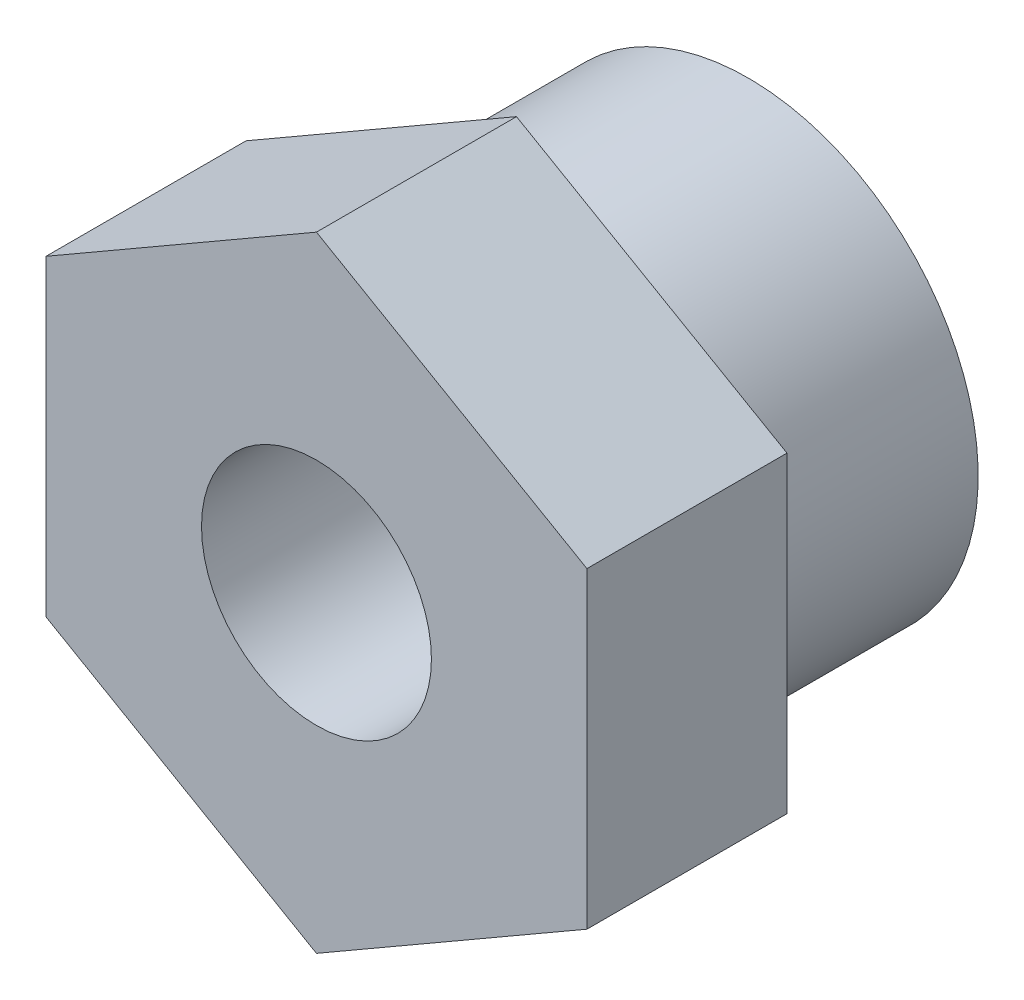
from build123d import *

# Parameters (mm, degrees)
SCHIZZO1_R                   = 17.25
ESTRUSIONE_ESTRUSIONE1_DEPTH = 23.85
TAGLIO_ESTRUSIONE1_START     = -11.05
TAGLIO_ESTRUSIONE1_DEPTH     = 11.05
FORO_25_5_12_7_1_D           = 12.7
SCHIZZO5_R                   = 17.25
SCHIZZO5_R_2                 = 12.7
TAGLIO_ESTRUSIONE2_DEPTH     = 12.8


with BuildPart() as part:
    # Schizzo1 → Estrusione-Estrusione1 (new body)
    with BuildSketch(Plane.XY):
        Circle(SCHIZZO1_R)
    extrude(amount=ESTRUSIONE_ESTRUSIONE1_DEPTH)

    # Schizzo2 → Taglio-Estrusione1 (cut)
    with BuildSketch(Plane.XY.offset(23.85).offset(TAGLIO_ESTRUSIONE1_START)):
        with BuildLine():
            ThreePointArc((14.938938215, 8.625), (8.625, 14.938938215), (0, 17.25))
            Line((0, 17.25), (14.938938215, 8.625))
        make_face()
        with BuildLine():
            Line((-14.938938215, 8.625), (0, 17.25))
            ThreePointArc((0, 17.25), (-8.625, 14.938938215), (-14.938938215, 8.625))
        make_face()
        with BuildLine():
            Line((-14.938938215, -8.625), (-14.938938215, 8.625))
            ThreePointArc((-14.938938215, 8.625), (-17.25, 0), (-14.938938215, -8.625))
        make_face()
        with BuildLine():
            ThreePointArc((14.938938215, -8.625), (17.25, 0), (14.938938215, 8.625))
            Line((14.938938215, 8.625), (14.938938215, -8.625))
        make_face()
        with BuildLine():
            Line((0, -17.25), (-14.938938215, -8.625))
            ThreePointArc((-14.938938215, -8.625), (-8.625, -14.938938215), (0, -17.25))
        make_face()
        with BuildLine():
            ThreePointArc((0, -17.25), (8.625, -14.938938215), (14.938938215, -8.625))
            Line((14.938938215, -8.625), (0, -17.25))
        make_face()
    extrude(amount=TAGLIO_ESTRUSIONE1_DEPTH, mode=Mode.SUBTRACT)

    # Foro Ø25.5 (12.7)-1 (through all)
    with Locations(Plane.XY.offset(23.85)):
        with Locations((0, 0)):
            Hole(FORO_25_5_12_7_1_D / 2)

    # Schizzo5 → Taglio-Estrusione2 (cut)
    with BuildSketch(Plane(origin=(0, 0, 0), x_dir=(-1, 0, 0), z_dir=(0, 0, -1))):
        Circle(SCHIZZO5_R)
        Circle(SCHIZZO5_R_2, mode=Mode.SUBTRACT)
    extrude(amount=-TAGLIO_ESTRUSIONE2_DEPTH, mode=Mode.SUBTRACT)


solid = part.part
